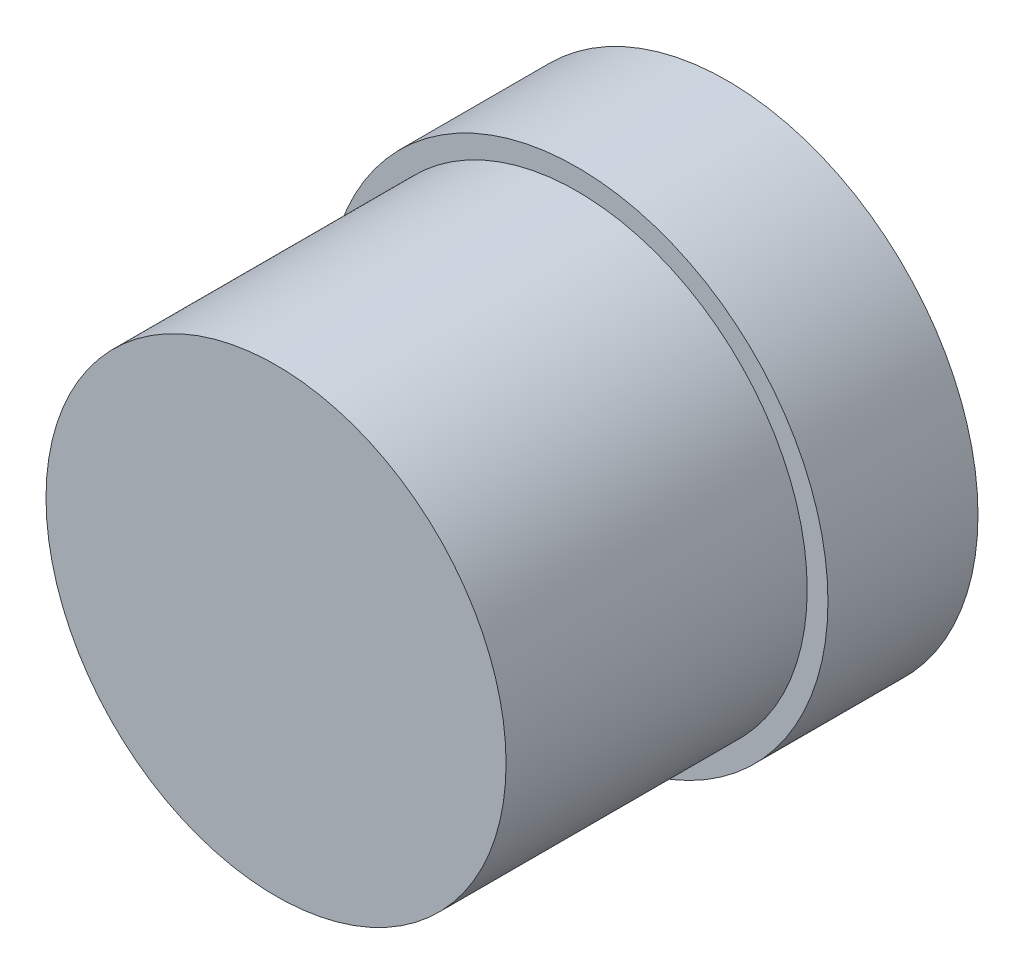
from build123d import *

# Parameters (mm, degrees)
SKETCH1_R           = 38.075
BOSS_EXTRUDE1_DEPTH = 68.5
SKETCH2_R           = 11.5
BOSS_EXTRUDE2_DEPTH = 6
CHAMFER1_SIZE       = 2
SKETCH3_R           = 21.075
CUT_EXTRUDE1_DEPTH  = 3
SKETCH8_R           = 38.075
SKETCH8_R_2         = 34.925
CUT_EXTRUDE2_DEPTH  = 45.72


with BuildPart() as part:
    # Sketch1 → Boss-Extrude1 (new body)
    with BuildSketch(Plane.XY):
        Circle(SKETCH1_R)
    extrude(amount=BOSS_EXTRUDE1_DEPTH)

    # Sketch2 → Boss-Extrude2 (add)
    with BuildSketch(Plane(origin=(0, 0, 0), x_dir=(-1, 0, 0), z_dir=(0, 0, -1))):
        Circle(SKETCH2_R)
    extrude(amount=BOSS_EXTRUDE2_DEPTH)

    # Chamfer1
    chamfer1_edges = [part.edges().sort_by_distance(p)[0] for p in [
        (11.5, 0, -6),
    ]]
    chamfer(chamfer1_edges, length=CHAMFER1_SIZE)

    # Sketch3 → Cut-Extrude1 (cut)
    with BuildSketch(Plane(origin=(0, 0, 0), x_dir=(-1, 0, 0), z_dir=(0, 0, -1))):
        Circle(SKETCH3_R)
    extrude(amount=-CUT_EXTRUDE1_DEPTH, mode=Mode.SUBTRACT)


with BuildPart() as cut_extrude1_piece_1:
    # of the separate pieces the step leaves, piece 1, a body of its own (cut_extrude1_pieces)
    add(part.part.solids().sort_by_distance((38.075, 0, 0))[0])

    # Sketch8 → Cut-Extrude2 (cut)
    with BuildSketch(Plane.XY.offset(68.5)):
        Circle(SKETCH8_R)
        Circle(SKETCH8_R_2, mode=Mode.SUBTRACT)
    extrude(amount=-CUT_EXTRUDE2_DEPTH, mode=Mode.SUBTRACT)


with BuildPart() as cut_extrude1_piece_2:
    # of the separate pieces the step leaves, piece 2, a body of its own (cut_extrude1_pieces)
    add(part.part.solids().sort_by_distance((-11.5, 0, -4))[0])


solid = Compound([cut_extrude1_piece_1.part, cut_extrude1_piece_2.part])
